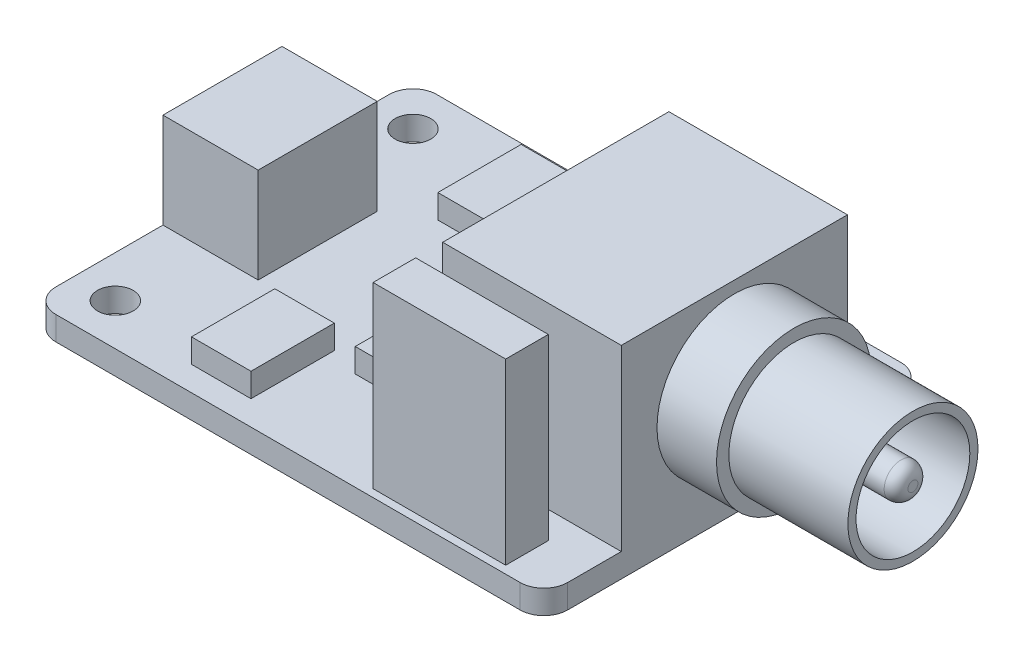
from build123d import *
from OCP.BRepFilletAPI import BRepFilletAPI_MakeChamfer

# Parameters (mm, degrees)
SKETCH1_W           = 43
SKETCH1_H           = 32
SKETCH1_R           = 1.5
BOSS_EXTRUDE1_DEPTH = 2
FILLET1_R           = 2
SKETCH2_W           = 15
SKETCH2_H           = 19
SKETCH2_W_2         = 11.140552481
SKETCH2_H_2         = 3.582781673
BOSS_EXTRUDE2_DEPTH = 15
SKETCH3_W           = 8
SKETCH3_H           = 10
BOSS_EXTRUDE3_DEPTH = 8
SKETCH4_W           = 5
SKETCH4_H           = 7
BOSS_EXTRUDE4_DEPTH = 2
SKETCH5_W           = 8
SKETCH5_H           = 6
SKETCH5_W_2         = 1
SKETCH5_H_2         = 1
CUT_EXTRUDE1_DEPTH  = 7
DRAFT1_ANGLE        = 1
CHAMFER1_SIZE       = 2.5
CHAMFER1_SIZE2      = 0.350545667
CHAMFER1_SIZE2_2    = 0.351352087
CHAMFER1_SIZE2_3    = 0.352269778
SKETCH6_R           = 6.5
BOSS_EXTRUDE5_DEPTH = 5
SKETCH7_R           = 5.464716876
BOSS_EXTRUDE6_DEPTH = 10
SKETCH8_R           = 4.778839206
SKETCH8_R_2         = 1.418417939
CUT_EXTRUDE2_DEPTH  = 15
FILLET3_R           = 1


with BuildPart() as part:
    # Sketch1 → Boss-Extrude1 (new body)
    with BuildSketch(Plane(origin=(0, 0, 0), x_dir=(1, 0, 0), z_dir=(0, 1, 0))):
        with Locations((-157.69047619, 62.928571429)):
            Rectangle(SKETCH1_W, SKETCH1_H)
        with Locations((-175.69047619, 75.428571429)):
            Circle(SKETCH1_R, mode=Mode.SUBTRACT)
        with Locations((-175.69047619, 50.428571429)):
            Circle(SKETCH1_R, mode=Mode.SUBTRACT)
    extrude(amount=BOSS_EXTRUDE1_DEPTH)

    # Fillet1
    fillet1_edges = [part.edges().sort_by_distance(p)[0] for p in [
        (-179.19047619, 1, -78.928571429),
        (-136.19047619, 1, -78.928571429),
        (-136.19047619, 1, -46.928571429),
        (-179.19047619, 1, -46.928571429),
    ]]
    fillet(fillet1_edges, radius=FILLET1_R)

    # Sketch2 → Boss-Extrude2 (add)
    with BuildSketch(Plane(origin=(0, 2, 0), x_dir=(1, 0, 0), z_dir=(0, 1, 0))):
        with Locations((-143.69047619, 62.928571429)):
            Rectangle(SKETCH2_W, SKETCH2_H)
        with Locations((-145.62019995, 49.369059298)):
            Rectangle(SKETCH2_W_2, SKETCH2_H_2)
    extrude(amount=BOSS_EXTRUDE2_DEPTH)

    # Sketch3 → Boss-Extrude3 (add)
    with BuildSketch(Plane(origin=(0, 2, 0), x_dir=(1, 0, 0), z_dir=(0, 1, 0))):
        with Locations((-175.19047619, 62.928571429)):
            Rectangle(SKETCH3_W, SKETCH3_H)
    extrude(amount=BOSS_EXTRUDE3_DEPTH)

    # Sketch4 → Boss-Extrude4 (add)
    with BuildSketch(Plane(origin=(0, 2, 0), x_dir=(1, 0, 0), z_dir=(0, 1, 0))):
        with Locations((-157.781788093, 68.484522729)):
            Rectangle(SKETCH4_W, SKETCH4_H)
        with Locations((-157.781788093, 58.672517023)):
            Rectangle(SKETCH4_W, SKETCH4_H)
        with Locations((-165.512552384, 73.341751138)):
            Rectangle(SKETCH4_W, SKETCH4_H)
        with Locations((-165.361321637, 52.495882076)):
            Rectangle(SKETCH4_W, SKETCH4_H)
    extrude(amount=BOSS_EXTRUDE4_DEPTH)

    # Sketch5 → Cut-Extrude1 (cut)
    with BuildSketch(Plane.ZY.offset(179.19047619)):
        with Locations((-62.928571429, 6)):
            Rectangle(SKETCH5_W, SKETCH5_H)
        with Locations((-65.228571429, 6)):
            Rectangle(SKETCH5_W_2, SKETCH5_H_2, mode=Mode.SUBTRACT)
        with Locations((-62.928571429, 6)):
            Rectangle(SKETCH5_W_2, SKETCH5_H_2, mode=Mode.SUBTRACT)
        with Locations((-60.628571429, 6)):
            Rectangle(SKETCH5_W_2, SKETCH5_H_2, mode=Mode.SUBTRACT)
    extrude(amount=-CUT_EXTRUDE1_DEPTH, mode=Mode.SUBTRACT)

    # Draft1
    draft1_faces = [part.faces().sort_by_distance(p)[0] for p in [
        (-179.19047619, 6, -65.228571429),
        (-179.19047619, 6, -60.628571429),
        (-179.19047619, 6, -62.928571429),
    ]]
    draft(draft1_faces, Plane(origin=(-172.19047619, 6.5, -63.428571429), x_dir=(0, 0, 1), z_dir=(0, 1, 0)), DRAFT1_ANGLE)

    # Chamfer1: one chamfer whose edges measure the first distance from different faces: ONE call of the kernel's chamfer builder (chamfer() names one face for all edges)
    chamfer1_edges_1 = [part.edges().sort_by_distance(p)[0] for p in [
        (-179.207931255, 5.5, -60.628571429),
    ]]
    chamfer1_side_1 = [part.faces().sort_by_distance(p)[0] for p in [
        (-175.699203723, 5.5, -60.628571429),
    ]]
    chamfer1_edges_2 = [part.edges().sort_by_distance(p)[0] for p in [
        (-179.199203723, 6, -60.128571429),
    ]]
    chamfer1_side_2 = [part.faces().sort_by_distance(p)[0] for p in [
        (-175.694841768, 5.99979246, -60.128571429),
    ]]
    chamfer1_edges_3 = [part.edges().sort_by_distance(p)[0] for p in [
        (-179.19047619, 6.5, -60.628571429),
    ]]
    chamfer1_side_3 = [part.faces().sort_by_distance(p)[0] for p in [
        (-175.69047619, 6.5, -60.628571429),
    ]]
    chamfer1_edges_4 = [part.edges().sort_by_distance(p)[0] for p in [
        (-179.199203723, 6, -61.128571429),
    ]]
    chamfer1_side_4 = [part.faces().sort_by_distance(p)[0] for p in [
        (-175.694841768, 5.99979246, -61.128571429),
    ]]
    chamfer1_edges_5 = [part.edges().sort_by_distance(p)[0] for p in [
        (-179.207931255, 5.5, -62.928571429),
    ]]
    chamfer1_side_5 = [part.faces().sort_by_distance(p)[0] for p in [
        (-175.699203723, 5.5, -62.928571429),
    ]]
    chamfer1_edges_6 = [part.edges().sort_by_distance(p)[0] for p in [
        (-179.199203723, 6, -62.428571429),
    ]]
    chamfer1_side_6 = [part.faces().sort_by_distance(p)[0] for p in [
        (-175.694841768, 5.99979246, -62.428571429),
    ]]
    chamfer1_edges_7 = [part.edges().sort_by_distance(p)[0] for p in [
        (-179.19047619, 6.5, -62.928571429),
    ]]
    chamfer1_side_7 = [part.faces().sort_by_distance(p)[0] for p in [
        (-175.69047619, 6.5, -62.928571429),
    ]]
    chamfer1_edges_8 = [part.edges().sort_by_distance(p)[0] for p in [
        (-179.199203723, 6, -63.428571429),
    ]]
    chamfer1_side_8 = [part.faces().sort_by_distance(p)[0] for p in [
        (-175.694841768, 5.99979246, -63.428571429),
    ]]
    chamfer1_edges_9 = [part.edges().sort_by_distance(p)[0] for p in [
        (-179.199203723, 6, -65.728571429),
    ]]
    chamfer1_side_9 = [part.faces().sort_by_distance(p)[0] for p in [
        (-175.694841768, 5.99979246, -65.728571429),
    ]]
    chamfer1_edges_10 = [part.edges().sort_by_distance(p)[0] for p in [
        (-179.207931255, 5.5, -65.228571429),
    ]]
    chamfer1_side_10 = [part.faces().sort_by_distance(p)[0] for p in [
        (-175.699203723, 5.5, -65.228571429),
    ]]
    chamfer1_edges_11 = [part.edges().sort_by_distance(p)[0] for p in [
        (-179.199203723, 6, -64.728571429),
    ]]
    chamfer1_side_11 = [part.faces().sort_by_distance(p)[0] for p in [
        (-175.694841768, 5.99979246, -64.728571429),
    ]]
    chamfer1_edges_12 = [part.edges().sort_by_distance(p)[0] for p in [
        (-179.19047619, 6.5, -65.228571429),
    ]]
    chamfer1_side_12 = [part.faces().sort_by_distance(p)[0] for p in [
        (-175.69047619, 6.5, -65.228571429),
    ]]
    chamfer1 = BRepFilletAPI_MakeChamfer(part.part.solid().wrapped)
    for e in chamfer1_edges_1:
        chamfer1.Add(CHAMFER1_SIZE, CHAMFER1_SIZE2, e.wrapped, chamfer1_side_1[0].wrapped)  # the first distance lies on this face
    for e in chamfer1_edges_2:
        chamfer1.Add(CHAMFER1_SIZE, CHAMFER1_SIZE2_2, e.wrapped, chamfer1_side_2[0].wrapped)  # the first distance lies on this face
    for e in chamfer1_edges_3:
        chamfer1.Add(CHAMFER1_SIZE, CHAMFER1_SIZE2_3, e.wrapped, chamfer1_side_3[0].wrapped)  # the first distance lies on this face
    for e in chamfer1_edges_4:
        chamfer1.Add(CHAMFER1_SIZE, CHAMFER1_SIZE2_2, e.wrapped, chamfer1_side_4[0].wrapped)  # the first distance lies on this face
    for e in chamfer1_edges_5:
        chamfer1.Add(CHAMFER1_SIZE, CHAMFER1_SIZE2, e.wrapped, chamfer1_side_5[0].wrapped)  # the first distance lies on this face
    for e in chamfer1_edges_6:
        chamfer1.Add(CHAMFER1_SIZE, CHAMFER1_SIZE2_2, e.wrapped, chamfer1_side_6[0].wrapped)  # the first distance lies on this face
    for e in chamfer1_edges_7:
        chamfer1.Add(CHAMFER1_SIZE, CHAMFER1_SIZE2_3, e.wrapped, chamfer1_side_7[0].wrapped)  # the first distance lies on this face
    for e in chamfer1_edges_8:
        chamfer1.Add(CHAMFER1_SIZE, CHAMFER1_SIZE2_2, e.wrapped, chamfer1_side_8[0].wrapped)  # the first distance lies on this face
    for e in chamfer1_edges_9:
        chamfer1.Add(CHAMFER1_SIZE, CHAMFER1_SIZE2_2, e.wrapped, chamfer1_side_9[0].wrapped)  # the first distance lies on this face
    for e in chamfer1_edges_10:
        chamfer1.Add(CHAMFER1_SIZE, CHAMFER1_SIZE2, e.wrapped, chamfer1_side_10[0].wrapped)  # the first distance lies on this face
    for e in chamfer1_edges_11:
        chamfer1.Add(CHAMFER1_SIZE, CHAMFER1_SIZE2_2, e.wrapped, chamfer1_side_11[0].wrapped)  # the first distance lies on this face
    for e in chamfer1_edges_12:
        chamfer1.Add(CHAMFER1_SIZE, CHAMFER1_SIZE2_3, e.wrapped, chamfer1_side_12[0].wrapped)  # the first distance lies on this face
    add(Compound.cast(chamfer1.Shape()), mode=Mode.REPLACE)

    # Sketch6 → Boss-Extrude5 (add)
    with BuildSketch(Plane(origin=(-136.19047619, 0, 0), x_dir=(0, 0, -1), z_dir=(1, 0, 0))):
        with Locations((62.928571429, 9.5)):
            Circle(SKETCH6_R)
    extrude(amount=BOSS_EXTRUDE5_DEPTH)

    # Sketch7 → Boss-Extrude6 (add)
    with BuildSketch(Plane(origin=(-131.19047619, 0, 0), x_dir=(0, 0, -1), z_dir=(1, 0, 0))):
        with Locations((62.928571429, 9.5)):
            Circle(SKETCH7_R)
    extrude(amount=BOSS_EXTRUDE6_DEPTH)

    # Sketch8 → Cut-Extrude2 (cut)
    with BuildSketch(Plane(origin=(-121.19047619, 0, 0), x_dir=(0, 0, -1), z_dir=(1, 0, 0))):
        with Locations((62.928571429, 9.5)):
            Circle(SKETCH8_R)
        with Locations((62.928571429, 9.5)):
            Circle(SKETCH8_R_2, mode=Mode.SUBTRACT)
    extrude(amount=-CUT_EXTRUDE2_DEPTH, mode=Mode.SUBTRACT)

    # Fillet3
    fillet3_edges = [part.edges().sort_by_distance(p)[0] for p in [
        (-121.19047619, 9.5, -61.51015349),
    ]]
    fillet(fillet3_edges, radius=FILLET3_R)


solid = part.part
